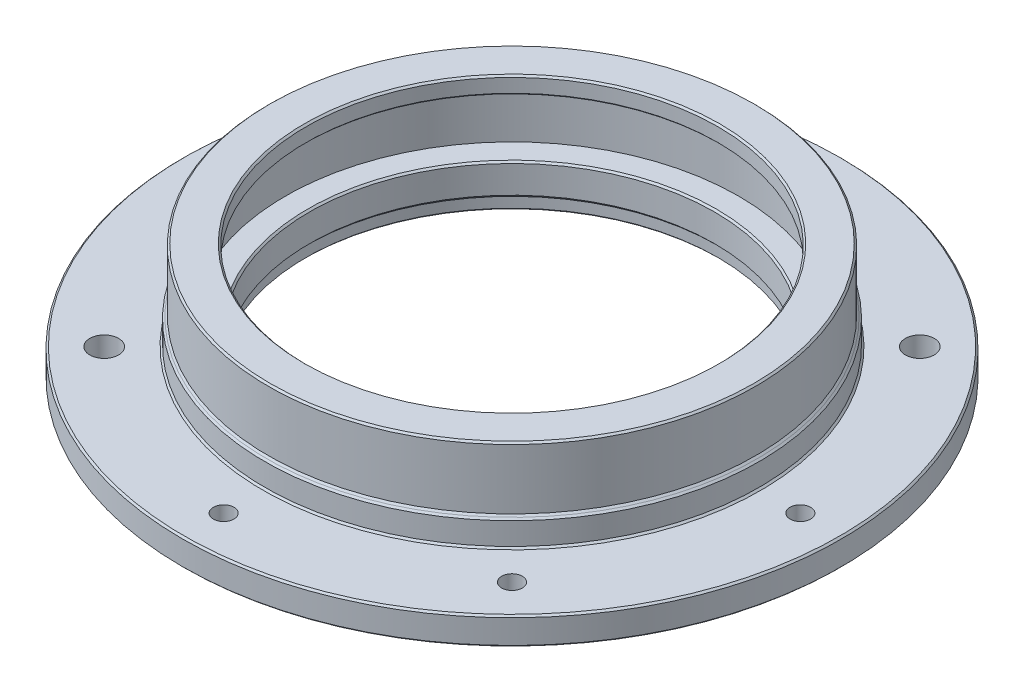
from build123d import *

# Parameters (mm, degrees)
SKETCH_2_R          = 1.5
SKETCH_2_R_2        = 2.1
CUT_EXTRUDE_1_DEPTH = 70.115844783
CHAMFER_1_SIZE      = 0.25
CHAMFER_2_SIZE      = 0.25


with BuildPart() as part:
    # 草图1 → 旋转1 (revolve)
    with BuildSketch(Plane.XY, mode=Mode.PRIVATE) as revolve_1_sk:
        Polygon((-48, 0), (-33.25, 0), (-33.25, 6.5), (-33, 6.5), (-33, 14.5), (-30, 14.5), (-30, 17), (-35.5, 17), (-35.5, 7.75), (-36, 7.75), (-36, 4), (-48, 4), align=None)
    revolve(revolve_1_sk.sketch.rotate(Axis((0, 0, 0), (0, 1, 0)), 270), axis=Axis((0, 0, 0), (0, 1, 0)))

    # 草图2 → 切除-拉伸1 (cut, through all)
    with BuildSketch(Plane(origin=(0, 4, 0), x_dir=(1, 0, 0), z_dir=(0, 1, 0))):
        with Locations(Location((-42, 0, 0), (0, 0, 270))):
            Circle(SKETCH_2_R)
        with Locations(Location((-29.69848481, 29.69848481, 0), (0, 0, 270))):
            Circle(SKETCH_2_R)
        with Locations(Location((0, 42, 0), (0, 0, 270))):
            Circle(SKETCH_2_R)
        with Locations(Location((42, 0, 0), (0, 0, 270))):
            Circle(SKETCH_2_R)
        with Locations(Location((29.69848481, -29.69848481, 0), (0, 0, 270))):
            Circle(SKETCH_2_R)
        with Locations(Location((0, -42, 0), (0, 0, 270))):
            Circle(SKETCH_2_R)
        with Locations(Location((-29.69848481, -29.69848481, 0), (0, 0, 270))):
            Circle(SKETCH_2_R_2)
        with Locations(Location((29.69848481, 29.69848481, 0), (0, 0, 90))):
            Circle(SKETCH_2_R_2)
    extrude(amount=-CUT_EXTRUDE_1_DEPTH, mode=Mode.SUBTRACT)

    # 倒角1
    chamfer_1_edges = [part.edges().sort_by_distance(p)[0] for p in [
        (0, 7.75, 36),
        (0, 7.75, 35.5),
        (0, 17, 35.5),
        (0, 17, 30),
        (0, 14.5, 30),
        (0, 0, 33.25),
        (0, 0, 48),
        (0, 4, 48),
        (0, 4, 36),
    ]]
    chamfer(chamfer_1_edges, length=CHAMFER_1_SIZE - 0.0001)  # a hair under: the kernel refuses the full size


with BuildPart() as body_2:
    # 草图3 → 旋转2 (revolve)
    with BuildSketch(Plane.XY, mode=Mode.PRIVATE) as revolve_2_sk:
        Polygon((-33.25, 0), (-33.25, 6.5), (-29.5, 6.5), (-29.5, 2), (-30, 2), (-30, 0), align=None)
    revolve(revolve_2_sk.sketch.rotate(Axis((0, 0, 0), (0, 1, 0)), 270), axis=Axis((0, 0, 0), (0, 1, 0)))

    # 倒角2
    chamfer_2_edges = [body_2.edges().sort_by_distance(p)[0] for p in [
        (0, 6.5, 33.25),
        (0, 0, 33.25),
        (0, 0, 30),
        (0, 2, 30),
        (0, 2, 29.5),
        (0, 6.5, 29.5),
    ]]
    chamfer(chamfer_2_edges, length=CHAMFER_2_SIZE - 0.0001)  # a hair under: the kernel refuses the full size


solid = Compound([part.part, body_2.part])
